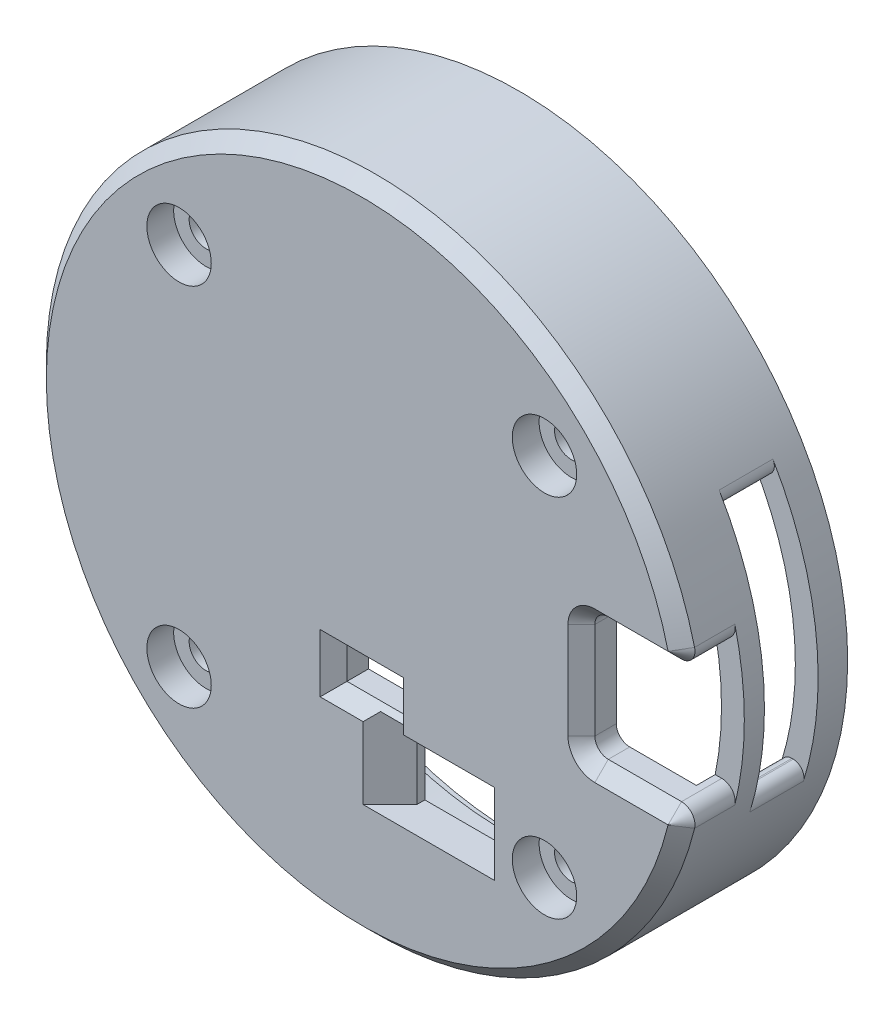
from build123d import *

# Parameters (mm, degrees)
SKETCH_2_R          = 24.5
SKETCH_2_R_2        = 23.6
EXTRUDE_3_DEPTH     = 11.7
SKETCH_2_5_R        = 23.6
SKETCH_2_5_R_2      = 22.8
EXTRUDE_4_DEPTH     = 10.7
SKETCH_2_6_R        = 2.7
SKETCH_2_6_R_2      = 2.3
SKETCH_2_6_W        = 5.8
SKETCH_2_6_H        = 6
SKETCH_2_6_W_2      = 4.2
SKETCH_2_6_H_2      = 2.343935591
EXTRUDE_5_DEPTH     = 2.6
SKETCH_2_7_R        = 2.4
SKETCH_2_7_R_2      = 1.25
EXTRUDE_6_DEPTH     = 4
EXTRUDE_6_2_DEPTH   = 4
EXTRUDE_6_3_DEPTH   = 4
EXTRUDE_6_4_DEPTH   = 4
SKETCH_2_20_R       = 2.3
EXTRUDE_10_DEPTH    = 1.5
SKETCH_2_9_R        = 2.7
SKETCH_2_9_R_2      = 1.25
SKETCH_2_9_R_3      = 2.4
EXTRUDE_7_DEPTH     = 4
CUT_EXTRUDE_2_DEPTH = 9.5
SKETCH_2_18_R       = 2.4
SKETCH_2_18_R_2     = 1.25
CUT_EXTRUDE_3_DEPTH = 2
SKETCH_2_14_R       = 24.5
SKETCH_2_14_R_2     = 22.8
EXTRUDE_9_DEPTH     = 5.5
CUT_EXTRUDE_4_DEPTH = 4
FILLET_2_R          = 0.8
FILLET_3_R          = 0.8
FILLET_4_R          = 0.8
FILLET_5_R          = 0.8
CHAMFER_1_SIZE      = 2
FILLET_6_R          = 1
CHAMFER_5_SIZE      = 1


with BuildPart() as part:
    # 草图2 → 凸台-拉伸3 (new body)
    with BuildSketch(Plane.XY):
        Circle(SKETCH_2_R)
        Circle(SKETCH_2_R_2, mode=Mode.SUBTRACT)
    extrude(amount=-EXTRUDE_3_DEPTH)

    # 草图2<5> → 凸台-拉伸4 (add)
    with BuildSketch(Plane.XY):
        Circle(SKETCH_2_5_R)
        Circle(SKETCH_2_5_R_2, mode=Mode.SUBTRACT)
    extrude(amount=-EXTRUDE_4_DEPTH)

    # 草图2<6> → 凸台-拉伸5 (add)
    with BuildSketch(Plane.XY):
        with BuildLine():
            Line((16.364288895, 4.6), (22.331144171, 4.6))
            ThreePointArc((22.331144171, 4.6), (21.351879352, 7.996077047), (19.85950654, 11.2))
            ThreePointArc((19.85950654, 11.2), (-22.638617972, -2.707946886), (21.940829519, -6.2))
            ThreePointArc((21.940829519, -6.2), (22.150438226, -5.403525366), (22.331144171, -4.6))
            Line((22.331144171, -4.6), (16.364288895, -4.6))
            Line((16.364288895, -4.6), (16.364288895, 4.6))
        make_face()
        with Locations((-13.611805538, -13.611805538)):
            Circle(SKETCH_2_6_R, mode=Mode.SUBTRACT)
        with Locations((-3.326426064, -13.341566236)):
            Circle(SKETCH_2_6_R_2, mode=Mode.SUBTRACT)
        with Locations((5, -12.65)):
            Rectangle(SKETCH_2_6_W, SKETCH_2_6_H, mode=Mode.SUBTRACT)
        with Locations((13.611805538, -13.611805538)):
            Circle(SKETCH_2_6_R, mode=Mode.SUBTRACT)
        with Locations((0, -8.128032205)):
            Rectangle(SKETCH_2_6_W_2, SKETCH_2_6_H_2, mode=Mode.SUBTRACT)
        with Locations((-9.020811649, 10.377256728)):
            Circle(SKETCH_2_6_R_2, mode=Mode.SUBTRACT)
        with Locations((-13.611805538, 13.611805538)):
            Circle(SKETCH_2_6_R, mode=Mode.SUBTRACT)
        with Locations((9.020811649, 10.377256728)):
            Circle(SKETCH_2_6_R_2, mode=Mode.SUBTRACT)
        with Locations((13.611805538, 13.611805538)):
            Circle(SKETCH_2_6_R, mode=Mode.SUBTRACT)
    extrude(amount=-EXTRUDE_5_DEPTH)

    # 草图2<20> → 凸台-拉伸10 (add)
    with BuildSketch(Plane.XY):
        with Locations((-9.020811649, 10.377256728)):
            Circle(SKETCH_2_20_R)
        with Locations((9.020811649, 10.377256728)):
            Circle(SKETCH_2_20_R)
        with Locations((-3.326426064, -13.341566236)):
            Circle(SKETCH_2_20_R)
    extrude(amount=-EXTRUDE_10_DEPTH)

    # 草图2<9> → 凸台-拉伸7 (add)
    # profile 1 of 8: a face of its own
    with BuildSketch(Plane.XY):
        with Locations((-13.611805538, 13.611805538)):
            Circle(SKETCH_2_9_R)
        with Locations((-13.611805538, 13.611805538)):
            Circle(SKETCH_2_9_R_2, mode=Mode.SUBTRACT)
    # profile 2 of 8: a face of its own
    with BuildSketch(Plane.XY):
        with Locations((13.611805538, 13.611805538)):
            Circle(SKETCH_2_9_R)
        with Locations((13.611805538, 13.611805538)):
            Circle(SKETCH_2_9_R_2, mode=Mode.SUBTRACT)
    # profile 3 of 8: a face of its own
    with BuildSketch(Plane.XY):
        with Locations((-13.611805538, 13.611805538)):
            Circle(SKETCH_2_9_R)
        with Locations((-13.611805538, 13.611805538)):
            Circle(SKETCH_2_9_R_3, mode=Mode.SUBTRACT)
    # profile 4 of 8: a face of its own
    with BuildSketch(Plane.XY):
        with Locations((13.611805538, 13.611805538)):
            Circle(SKETCH_2_9_R)
        with Locations((13.611805538, 13.611805538)):
            Circle(SKETCH_2_9_R_3, mode=Mode.SUBTRACT)
    # profile 5 of 8: a face of its own
    with BuildSketch(Plane.XY):
        with Locations((13.611805538, -13.611805538)):
            Circle(SKETCH_2_9_R)
        with Locations((13.611805538, -13.611805538)):
            Circle(SKETCH_2_9_R_3, mode=Mode.SUBTRACT)
    # profile 6 of 8: a face of its own
    with BuildSketch(Plane.XY):
        with Locations((-13.611805538, -13.611805538)):
            Circle(SKETCH_2_9_R)
        with Locations((-13.611805538, -13.611805538)):
            Circle(SKETCH_2_9_R_3, mode=Mode.SUBTRACT)
    # profile 7 of 8: a face of its own
    with BuildSketch(Plane.XY):
        with Locations((-13.611805538, -13.611805538)):
            Circle(SKETCH_2_9_R_3)
        with Locations((-13.611805538, -13.611805538)):
            Circle(SKETCH_2_9_R_2, mode=Mode.SUBTRACT)
    # profile 8 of 8: a face of its own
    with BuildSketch(Plane.XY):
        with Locations((13.611805538, -13.611805538)):
            Circle(SKETCH_2_9_R_3)
        with Locations((13.611805538, -13.611805538)):
            Circle(SKETCH_2_9_R_2, mode=Mode.SUBTRACT)
    extrude(amount=-EXTRUDE_7_DEPTH)

    # 草图2<13> → 切除-拉伸2 (cut)
    with BuildSketch(Plane.XY):
        with BuildLine():
            Line((21.790135383, 11.2), (19.85950654, 11.2))
            ThreePointArc((19.85950654, 11.2), (22.638617972, 2.707946886), (21.940829519, -6.2))
            Line((21.940829519, -6.2), (23.70253151, -6.2))
            ThreePointArc((23.70253151, -6.2), (24.353350596, 2.676623757), (21.790135383, 11.2))
        make_face()
    extrude(amount=-CUT_EXTRUDE_2_DEPTH, mode=Mode.SUBTRACT)


with BuildPart() as body_2:
    # 草图2<7> → 凸台-拉伸6 (new body)
    with BuildSketch(Plane.XY):
        with Locations((13.611805538, 13.611805538)):
            Circle(SKETCH_2_7_R)
        with Locations((13.611805538, 13.611805538)):
            Circle(SKETCH_2_7_R_2, mode=Mode.SUBTRACT)
    extrude(amount=-EXTRUDE_6_DEPTH)


with BuildPart() as body_3:
    # 草图2<7> → Extrude 6 2 (new body)
    with BuildSketch(Plane.XY):
        with Locations((-13.611805538, 13.611805538)):
            Circle(SKETCH_2_7_R)
        with Locations((-13.611805538, 13.611805538)):
            Circle(SKETCH_2_7_R_2, mode=Mode.SUBTRACT)
    extrude(amount=-EXTRUDE_6_2_DEPTH)


with BuildPart() as body_4:
    # 草图2<7> → Extrude 6 3 (new body)
    with BuildSketch(Plane.XY):
        with Locations((13.611805538, -13.611805538)):
            Circle(SKETCH_2_7_R)
        with Locations((13.611805538, -13.611805538)):
            Circle(SKETCH_2_7_R_2, mode=Mode.SUBTRACT)
    extrude(amount=-EXTRUDE_6_3_DEPTH)


with BuildPart() as body_5:
    # 草图2<7> → Extrude 6 4 (new body)
    with BuildSketch(Plane.XY):
        with Locations((-13.611805538, -13.611805538)):
            Circle(SKETCH_2_7_R)
        with Locations((-13.611805538, -13.611805538)):
            Circle(SKETCH_2_7_R_2, mode=Mode.SUBTRACT)
    extrude(amount=-EXTRUDE_6_4_DEPTH)


with BuildPart() as cut_extrude_3_tool:
    # 草图2<18> → 切除-拉伸3 (new body)
    # profile 1 of 4: a face of its own
    with BuildSketch(Plane.XY):
        with Locations((13.611805538, 13.611805538)):
            Circle(SKETCH_2_18_R)
        with Locations((13.611805538, 13.611805538)):
            Circle(SKETCH_2_18_R_2, mode=Mode.SUBTRACT)
    # profile 2 of 4: a face of its own
    with BuildSketch(Plane.XY):
        with Locations((13.611805538, -13.611805538)):
            Circle(SKETCH_2_18_R)
        with Locations((13.611805538, -13.611805538)):
            Circle(SKETCH_2_18_R_2, mode=Mode.SUBTRACT)
    # profile 3 of 4: a face of its own
    with BuildSketch(Plane.XY):
        with Locations((-13.611805538, -13.611805538)):
            Circle(SKETCH_2_18_R)
        with Locations((-13.611805538, -13.611805538)):
            Circle(SKETCH_2_18_R_2, mode=Mode.SUBTRACT)
    # profile 4 of 4: a face of its own
    with BuildSketch(Plane.XY):
        with Locations((-13.611805538, 13.611805538)):
            Circle(SKETCH_2_18_R)
        with Locations((-13.611805538, 13.611805538)):
            Circle(SKETCH_2_18_R_2, mode=Mode.SUBTRACT)
    extrude(amount=-CUT_EXTRUDE_3_DEPTH)


with BuildPart() as part_1:
    add(part.part)

    # 切除-拉伸3: cut by cut_extrude_3_tool
    add(cut_extrude_3_tool.part, mode=Mode.SUBTRACT)

    # 草图2<14> → 凸台-拉伸9 (add)
    with BuildSketch(Plane.XY):
        Circle(SKETCH_2_14_R)
        Circle(SKETCH_2_14_R_2, mode=Mode.SUBTRACT)
    extrude(amount=-EXTRUDE_9_DEPTH)

    # 草图2<19> → 切除-拉伸4 (cut)
    with BuildSketch(Plane.XY):
        with BuildLine():
            ThreePointArc((23.6, 0), (23.486565903, 2.311108411), (23.14735406, 4.6))
            Line((23.14735406, 4.6), (22.331144171, 4.6))
            ThreePointArc((22.331144171, 4.6), (22.682483188, 2.311916185), (22.8, 0))
            ThreePointArc((22.8, 0), (22.682483188, -2.311916185), (22.331144171, -4.6))
            Line((22.331144171, -4.6), (23.14735406, -4.6))
            ThreePointArc((23.14735406, -4.6), (23.486565903, -2.311108411), (23.6, 0))
        make_face()
        with BuildLine():
            ThreePointArc((24.5, 0), (24.390828993, 2.310294579), (24.064288895, 4.6))
            Line((24.064288895, 4.6), (23.14735406, 4.6))
            ThreePointArc((23.14735406, 4.6), (23.486565903, 2.311108411), (23.6, 0))
            ThreePointArc((23.6, 0), (23.486565903, -2.311108411), (23.14735406, -4.6))
            Line((23.14735406, -4.6), (24.064288895, -4.6))
            ThreePointArc((24.064288895, -4.6), (24.390828993, -2.310294579), (24.5, 0))
        make_face()
    extrude(amount=-CUT_EXTRUDE_4_DEPTH, mode=Mode.SUBTRACT)

    # 圆角2
    fillet_2_edges = [part_1.edges().sort_by_distance(p)[0] for p in [
        (21.790135383, 11.2, -7.5),
    ]]
    fillet(fillet_2_edges, radius=FILLET_2_R)

    # 圆角3
    fillet_3_edges = [part_1.edges().sort_by_distance(p)[0] for p in [
        (23.70253151, -6.2, -7.5),
    ]]
    fillet(fillet_3_edges, radius=FILLET_3_R)

    # 圆角4
    fillet_4_edges = [part_1.edges().sort_by_distance(p)[0] for p in [
        (21.940829519, -6.2, -7.5),
    ]]
    fillet(fillet_4_edges, radius=FILLET_4_R)

    # 圆角5
    fillet_5_edges = [part_1.edges().sort_by_distance(p)[0] for p in [
        (19.85950654, 11.2, -7.5),
    ]]
    fillet(fillet_5_edges, radius=FILLET_5_R)

    # 倒角1
    chamfer_1_edges = [part_1.edges().sort_by_distance(p)[0] for p in [
        (2.1, -12.65, 0),
        (7.9, -12.65, 0),
    ]]
    chamfer(chamfer_1_edges, length=CHAMFER_1_SIZE)

    # 倒角4
    # the kernel refuses this chamfer: 1 mm, written as the material it takes off along each edge
    with BuildSketch(Plane(origin=(-2.1, -6.956064409, 0), x_dir=(0, 0.9996219169112968, 0.027495876610586365), z_dir=(1, 0, 0)), Plane(origin=(2.1, -9.3, 0), x_dir=(0, -0.9996219169112968, 0.02749587661058639), z_dir=(-1, 0, 0))) as chamfer_4_piece_1:
        with BuildLine():
            Line((1.028673195, 0), (-0.056547155, -1.027117794))
            Line((-0.056547155, -1.027117794), (-0.076539593, -1.026567876))
            ThreePointArc((-0.076539593, -1.026567876), (-0.034129227, -0.51339783), (-0.019992438, 0.000549918))
            Line((-0.019992438, 0.000549918), (0.000549918, 0.019992438))
            ThreePointArc((0.000549918, 0.019992438), (0.514497665, 0.00585565), (1.029223113, 0.019992438))
            Line((1.029223113, 0.019992438), (1.028673195, 0))
        make_face()
    extrude(amount=4.2, mode=Mode.SUBTRACT)
    with BuildSketch(Plane(origin=(-2.1, -9.3, 0), x_dir=(-0.9996219169112968, 0, 0.027495876610586365), z_dir=(0, 1, 0)), Plane(origin=(2.1, -6.956064409, 0), x_dir=(0.9996219169112968, 0, 0.027495876610586365), z_dir=(0, -1, 0))) as chamfer_4_piece_2:
        with BuildLine():
            Line((1.028673195, 0), (-0.056547155, -1.027117794))
            Line((-0.056547155, -1.027117794), (-0.076539593, -1.026567876))
            ThreePointArc((-0.076539593, -1.026567876), (-0.034129227, -0.51339783), (-0.019992438, 0.000549918))
            Line((-0.019992438, 0.000549918), (0.000549918, 0.019992438))
            ThreePointArc((0.000549918, 0.019992438), (0.514497665, 0.00585565), (1.029223113, 0.019992438))
            Line((1.029223113, 0.019992438), (1.028673195, 0))
        make_face()
    extrude(amount=2.343935591, mode=Mode.SUBTRACT)
    with BuildSketch(Plane(origin=(-2.1, -9.3, 0), x_dir=(-0.9996219169112968, 0, 0.027495876610586365), z_dir=(0, 1, 0))) as chamfer_4_piece_3a_section:
        with BuildLine():
            Line((1.028673195, 0), (-0.056547155, -1.027117794))
            Line((-0.056547155, -1.027117794), (-0.076539593, -1.026567876))
            ThreePointArc((-0.076539593, -1.026567876), (-0.034129227, -0.51339783), (-0.019992438, 0.000549918))
            Line((-0.019992438, 0.000549918), (0.000549918, 0.019992438))
            ThreePointArc((0.000549918, 0.019992438), (0.514497665, 0.00585565), (1.029223113, 0.019992438))
            Line((1.029223113, 0.019992438), (1.028673195, 0))
        make_face()
    chamfer_4_piece_3a = extrude(amount=4.915618579, mode=Mode.PRIVATE)
    chamfer_4_piece_3a = split(chamfer_4_piece_3a, bisect_by=Plane(origin=(-2.429793627, -6.956064409, -0.329793627), z_dir=(0, 1, 0)), keep=Keep.TOP, mode=Mode.PRIVATE)
    with BuildSketch(Plane(origin=(-4.671682988, -6.956064409, 0), x_dir=(0, 0.9996219169112968, 0.027495876610586365), z_dir=(1, 0, 0))) as chamfer_4_piece_3b_section:
        with BuildLine():
            Line((1.028673195, 0), (-0.056547155, -1.027117794))
            Line((-0.056547155, -1.027117794), (-0.076539593, -1.026567876))
            ThreePointArc((-0.076539593, -1.026567876), (-0.034129227, -0.51339783), (-0.019992438, 0.000549918))
            Line((-0.019992438, 0.000549918), (0.000549918, 0.019992438))
            ThreePointArc((0.000549918, 0.019992438), (0.514497665, 0.00585565), (1.029223113, 0.019992438))
            Line((1.029223113, 0.019992438), (1.028673195, 0))
        make_face()
    chamfer_4_piece_3b = extrude(amount=6.771682988, mode=Mode.PRIVATE)
    chamfer_4_piece_3b = split(chamfer_4_piece_3b, bisect_by=Plane(origin=(-2.1, -6.626270782, -0.329793627), z_dir=(-1, 0, 0)), keep=Keep.TOP, mode=Mode.PRIVATE)
    chamfer_4_piece_3 = chamfer_4_piece_3a & chamfer_4_piece_3b
    add(chamfer_4_piece_3, mode=Mode.SUBTRACT)
    with BuildSketch(Plane(origin=(-2.1, -6.956064409, 0), x_dir=(0, 0.9996219169112968, 0.027495876610586365), z_dir=(1, 0, 0))) as chamfer_4_piece_4a_section:
        with BuildLine():
            Line((1.028673195, 0), (-0.056547155, -1.027117794))
            Line((-0.056547155, -1.027117794), (-0.076539593, -1.026567876))
            ThreePointArc((-0.076539593, -1.026567876), (-0.034129227, -0.51339783), (-0.019992438, 0.000549918))
            Line((-0.019992438, 0.000549918), (0.000549918, 0.019992438))
            ThreePointArc((0.000549918, 0.019992438), (0.514497665, 0.00585565), (1.029223113, 0.019992438))
            Line((1.029223113, 0.019992438), (1.028673195, 0))
        make_face()
    chamfer_4_piece_4a = extrude(amount=6.771682988, mode=Mode.PRIVATE)
    chamfer_4_piece_4a = split(chamfer_4_piece_4a, bisect_by=Plane(origin=(2.1, -6.626270782, -0.329793627), z_dir=(1, 0, 0)), keep=Keep.TOP, mode=Mode.PRIVATE)
    with BuildSketch(Plane(origin=(2.1, -4.384381421, 0), x_dir=(0.9996219169112968, 0, 0.027495876610586365), z_dir=(0, -1, 0))) as chamfer_4_piece_4b_section:
        with BuildLine():
            Line((1.028673195, 0), (-0.056547155, -1.027117794))
            Line((-0.056547155, -1.027117794), (-0.076539593, -1.026567876))
            ThreePointArc((-0.076539593, -1.026567876), (-0.034129227, -0.51339783), (-0.019992438, 0.000549918))
            Line((-0.019992438, 0.000549918), (0.000549918, 0.019992438))
            ThreePointArc((0.000549918, 0.019992438), (0.514497665, 0.00585565), (1.029223113, 0.019992438))
            Line((1.029223113, 0.019992438), (1.028673195, 0))
        make_face()
    chamfer_4_piece_4b = extrude(amount=4.915618579, mode=Mode.PRIVATE)
    chamfer_4_piece_4b = split(chamfer_4_piece_4b, bisect_by=Plane(origin=(2.429793627, -6.956064409, -0.329793627), z_dir=(0, 1, 0)), keep=Keep.TOP, mode=Mode.PRIVATE)
    chamfer_4_piece_4 = chamfer_4_piece_4a & chamfer_4_piece_4b
    add(chamfer_4_piece_4, mode=Mode.SUBTRACT)
    with BuildSketch(Plane(origin=(-2.1, -11.871682988, 0), x_dir=(-0.9996219169112968, 0, 0.027495876610586365), z_dir=(0, 1, 0))) as chamfer_4_piece_5a_section:
        with BuildLine():
            Line((1.028673195, 0), (-0.056547155, -1.027117794))
            Line((-0.056547155, -1.027117794), (-0.076539593, -1.026567876))
            ThreePointArc((-0.076539593, -1.026567876), (-0.034129227, -0.51339783), (-0.019992438, 0.000549918))
            Line((-0.019992438, 0.000549918), (0.000549918, 0.019992438))
            ThreePointArc((0.000549918, 0.019992438), (0.514497665, 0.00585565), (1.029223113, 0.019992438))
            Line((1.029223113, 0.019992438), (1.028673195, 0))
        make_face()
    chamfer_4_piece_5a = extrude(amount=4.915618579, mode=Mode.PRIVATE)
    chamfer_4_piece_5a = split(chamfer_4_piece_5a, bisect_by=Plane(origin=(-2.429793627, -9.3, -0.329793627), z_dir=(0, -1, 0)), keep=Keep.TOP, mode=Mode.PRIVATE)
    with BuildSketch(Plane(origin=(2.1, -9.3, 0), x_dir=(0, -0.9996219169112968, 0.02749587661058639), z_dir=(-1, 0, 0))) as chamfer_4_piece_5b_section:
        with BuildLine():
            Line((1.028673195, 0), (-0.056547155, -1.027117794))
            Line((-0.056547155, -1.027117794), (-0.076539593, -1.026567876))
            ThreePointArc((-0.076539593, -1.026567876), (-0.034129227, -0.51339783), (-0.019992438, 0.000549918))
            Line((-0.019992438, 0.000549918), (0.000549918, 0.019992438))
            ThreePointArc((0.000549918, 0.019992438), (0.514497665, 0.00585565), (1.029223113, 0.019992438))
            Line((1.029223113, 0.019992438), (1.028673195, 0))
        make_face()
    chamfer_4_piece_5b = extrude(amount=6.771682988, mode=Mode.PRIVATE)
    chamfer_4_piece_5b = split(chamfer_4_piece_5b, bisect_by=Plane(origin=(-2.1, -9.629793627, -0.329793627), z_dir=(-1, 0, 0)), keep=Keep.TOP, mode=Mode.PRIVATE)
    chamfer_4_piece_5 = chamfer_4_piece_5a & chamfer_4_piece_5b
    add(chamfer_4_piece_5, mode=Mode.SUBTRACT)
    with BuildSketch(Plane(origin=(2.1, -6.956064409, 0), x_dir=(0.9996219169112968, 0, 0.027495876610586365), z_dir=(0, -1, 0))) as chamfer_4_piece_6a_section:
        with BuildLine():
            Line((1.028673195, 0), (-0.056547155, -1.027117794))
            Line((-0.056547155, -1.027117794), (-0.076539593, -1.026567876))
            ThreePointArc((-0.076539593, -1.026567876), (-0.034129227, -0.51339783), (-0.019992438, 0.000549918))
            Line((-0.019992438, 0.000549918), (0.000549918, 0.019992438))
            ThreePointArc((0.000549918, 0.019992438), (0.514497665, 0.00585565), (1.029223113, 0.019992438))
            Line((1.029223113, 0.019992438), (1.028673195, 0))
        make_face()
    chamfer_4_piece_6a = extrude(amount=4.915618579, mode=Mode.PRIVATE)
    chamfer_4_piece_6a = split(chamfer_4_piece_6a, bisect_by=Plane(origin=(2.429793627, -9.3, -0.329793627), z_dir=(0, -1, 0)), keep=Keep.TOP, mode=Mode.PRIVATE)
    with BuildSketch(Plane(origin=(4.671682988, -9.3, 0), x_dir=(0, -0.9996219169112968, 0.02749587661058639), z_dir=(-1, 0, 0))) as chamfer_4_piece_6b_section:
        with BuildLine():
            Line((1.028673195, 0), (-0.056547155, -1.027117794))
            Line((-0.056547155, -1.027117794), (-0.076539593, -1.026567876))
            ThreePointArc((-0.076539593, -1.026567876), (-0.034129227, -0.51339783), (-0.019992438, 0.000549918))
            Line((-0.019992438, 0.000549918), (0.000549918, 0.019992438))
            ThreePointArc((0.000549918, 0.019992438), (0.514497665, 0.00585565), (1.029223113, 0.019992438))
            Line((1.029223113, 0.019992438), (1.028673195, 0))
        make_face()
    chamfer_4_piece_6b = extrude(amount=6.771682988, mode=Mode.PRIVATE)
    chamfer_4_piece_6b = split(chamfer_4_piece_6b, bisect_by=Plane(origin=(2.1, -9.629793627, -0.329793627), z_dir=(1, 0, 0)), keep=Keep.TOP, mode=Mode.PRIVATE)
    chamfer_4_piece_6 = chamfer_4_piece_6a & chamfer_4_piece_6b
    add(chamfer_4_piece_6, mode=Mode.SUBTRACT)

    # 圆角6
    fillet_6_edges = [part_1.edges().sort_by_distance(p)[0] for p in [
        (24.064288895, 4.6, -2),
        (24.064288895, -4.6, -2),
        (16.364288895, 4.6, -1.3),
        (16.364288895, -4.6, -1.3),
    ]]
    fillet(fillet_6_edges, radius=FILLET_6_R)

    # 倒角5
    chamfer_5_edges = [part_1.edges().sort_by_distance(p)[0] for p in [
        (20.093651797, 4.6, 0),
        (-24.5, 0, 0),
        (20.093651797, -4.6, 0),
        (16.364288895, 0, 0),
        (23.609874876, -4.982868682, 0),
        (23.609874876, 4.982868682, 0),
        (16.657182113, 4.307106781, 0),
        (16.657182113, -4.307106781, 0),
    ]]
    chamfer(chamfer_5_edges, length=CHAMFER_5_SIZE)


with BuildPart() as body_2_1:
    add(body_2.part)

    # 切除-拉伸3: cut by cut_extrude_3_tool
    add(cut_extrude_3_tool.part, mode=Mode.SUBTRACT)


with BuildPart() as body_3_1:
    add(body_3.part)

    # 切除-拉伸3: cut by cut_extrude_3_tool
    add(cut_extrude_3_tool.part, mode=Mode.SUBTRACT)


with BuildPart() as body_4_1:
    add(body_4.part)

    # 切除-拉伸3: cut by cut_extrude_3_tool
    add(cut_extrude_3_tool.part, mode=Mode.SUBTRACT)


with BuildPart() as body_5_1:
    add(body_5.part)

    # 切除-拉伸3: cut by cut_extrude_3_tool
    add(cut_extrude_3_tool.part, mode=Mode.SUBTRACT)


solid = Compound([part_1.part, body_2_1.part, body_3_1.part, body_4_1.part, body_5_1.part])
